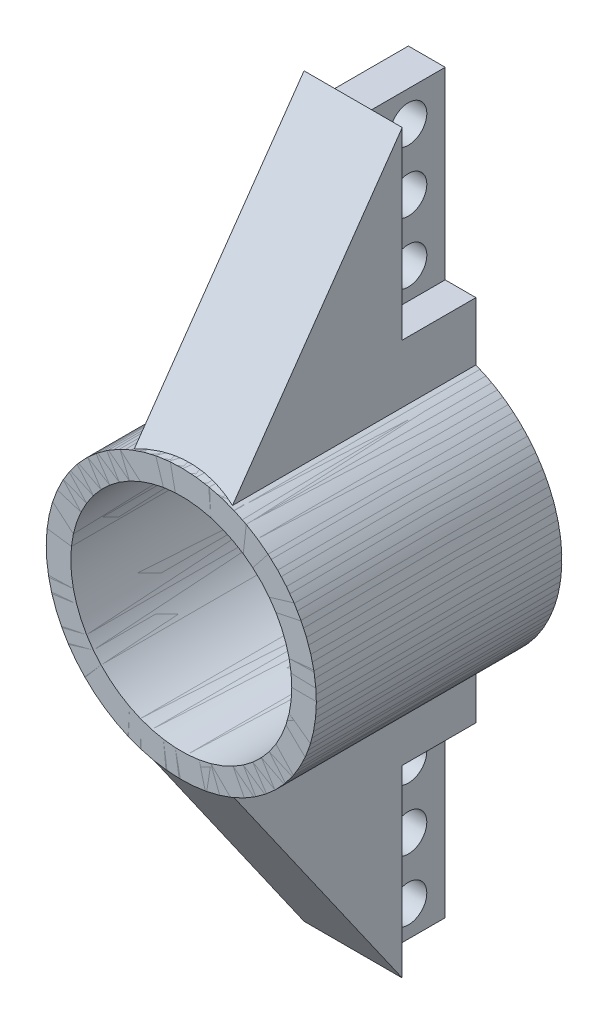
from build123d import *

# Parameters (mm, degrees)
SKETCH1_R             = 11
SKETCH1_R_2           = 9
BOSS_EXTRUDE1_DEPTH   = 20
BOSS_EXTRUDE2_DEPTH   = 4
SKETCH3_W             = 2.5
SKETCH3_H             = 6
CUT_EXTRUDE1_DEPTH    = 15
BODY_MOVE_COPY1_ANGLE = 180
SKETCH4_R             = 9
CUT_EXTRUDE2_DEPTH    = 38.69615365
SKETCH6_R             = 1.5
CUT_EXTRUDE3_DEPTH    = 39.160843806
SKETCH7_R             = 1.5
CUT_EXTRUDE4_DEPTH    = 39.160843806


with BuildPart() as part:
    # Sketch1 → Boss-Extrude1 (new body)
    with BuildSketch(Plane.XY):
        Circle(SKETCH1_R)
        Circle(SKETCH1_R_2, mode=Mode.SUBTRACT)
    extrude(amount=BOSS_EXTRUDE1_DEPTH)

    # Sketch2 → Boss-Extrude2 (add, symmetric)
    with BuildSketch(Plane(origin=(0, 0, 0), x_dir=(0, 0, -1), z_dir=(1, 0, 0))):
        Polygon((-20, 10), (-20, 6.5), (0, 6.5), (0, 30), (-6, 30), align=None)
    extrude(amount=BOSS_EXTRUDE2_DEPTH, both=True)

    # Sketch3 → Cut-Extrude1 (cut)
    with BuildSketch(Plane(origin=(0, 30, 0), x_dir=(1, 0, 0), z_dir=(0, 1, 0))):
        with Locations((-2.75, -3)):
            Rectangle(SKETCH3_W, SKETCH3_H)
        with Locations((2.75, -3)):
            Rectangle(SKETCH3_W, SKETCH3_H)
    extrude(amount=-CUT_EXTRUDE1_DEPTH, mode=Mode.SUBTRACT)


with BuildPart() as body_2:
    # Body-Move/Copy1: copy of part
    add(part.part.rotate(Axis((0, 0, 0), (0, 0, 1)), BODY_MOVE_COPY1_ANGLE))


with BuildPart() as cut_extrude2_tool:
    # Sketch4 → Cut-Extrude2 (new, through all)
    with BuildSketch(Plane(origin=(0, 0, 0), x_dir=(-1, 0, 0), z_dir=(0, 0, -1))):
        Circle(SKETCH4_R)
    extrude(amount=-CUT_EXTRUDE2_DEPTH)


with BuildPart() as part_1:
    add(part.part)

    # Cut-Extrude2: cut by cut_extrude2_tool
    add(cut_extrude2_tool.part, mode=Mode.SUBTRACT)

    # Sketch6 → Cut-Extrude3 (cut, through all)
    with BuildSketch(Plane.ZY.offset(1.5)):
        with Locations((3, 17.5)):
            Circle(SKETCH6_R)
        with Locations((3, 22.5)):
            Circle(SKETCH6_R)
        with Locations((3, 27.5)):
            Circle(SKETCH6_R)
    extrude(amount=-CUT_EXTRUDE3_DEPTH, mode=Mode.SUBTRACT)


with BuildPart() as body_2_1:
    add(body_2.part)

    # Cut-Extrude2: cut by cut_extrude2_tool
    add(cut_extrude2_tool.part, mode=Mode.SUBTRACT)

    # Sketch7 → Cut-Extrude4 (cut, through all)
    with BuildSketch(Plane.ZY.offset(1.5)):
        with Locations((3, -17.5)):
            Circle(SKETCH7_R)
        with Locations((3, -22.5)):
            Circle(SKETCH7_R)
        with Locations((3, -27.5)):
            Circle(SKETCH7_R)
    extrude(amount=-CUT_EXTRUDE4_DEPTH, mode=Mode.SUBTRACT)


solid = Compound([part_1.part, body_2_1.part])
